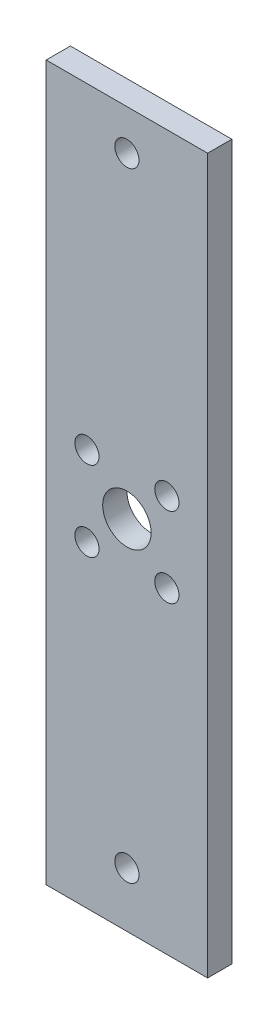
from build123d import *

# Parameters (mm, degrees)
SKETCH_1_W           = 170.943732818
SKETCH_1_H           = 105.520822726
EXTRUDE_1_DEPTH      = 3
SKETCH_3_OUTSIDE_W   = 213.126
SKETCH_3_OUTSIDE_H   = 147.702
SKETCH_3_OUTSIDE_W_2 = 20
SKETCH_3_OUTSIDE_H_2 = 88.500028981
CUT_EXTRUDE_1_DEPTH  = 101.489307663
SKETCH_2_R           = 1.5
SKETCH_2_R_2         = 3
CUT_EXTRUDE_2_DEPTH  = 51.191598861
SKETCH_4_R           = 1.5
CUT_EXTRUDE_3_DEPTH  = 51.191598861


with BuildPart() as part:
    # 草图1 → 凸台-拉伸1 (new body)
    with BuildSketch(Plane.XY):
        Rectangle(SKETCH_1_W, SKETCH_1_H)
    extrude(amount=EXTRUDE_1_DEPTH)

    # 草图3 outside → 切除-拉伸1 (cut, through all)
    with BuildSketch(Plane.XY.offset(3)):
        Rectangle(SKETCH_3_OUTSIDE_W, SKETCH_3_OUTSIDE_H)
        with Locations((-12.004302498, 0.761175983)):
            Rectangle(SKETCH_3_OUTSIDE_W_2, SKETCH_3_OUTSIDE_H_2, mode=Mode.SUBTRACT)
    extrude(amount=-CUT_EXTRUDE_1_DEPTH, mode=Mode.SUBTRACT)

    # 草图2 → 切除-拉伸2 (cut, through all)
    with BuildSketch(Plane(origin=(0, 0, 0), x_dir=(-1, 0, 0), z_dir=(0, 0, -1))):
        with Locations((7.05455503, 5.71092345)):
            Circle(SKETCH_2_R)
        with Locations((16.954049967, 5.71092345)):
            Circle(SKETCH_2_R)
        with Locations((16.954049967, -4.188571486)):
            Circle(SKETCH_2_R)
        with Locations((7.05455503, -4.188571486)):
            Circle(SKETCH_2_R)
        with Locations((12.004302498, 0.761175982)):
            Circle(SKETCH_2_R_2)
    extrude(amount=-CUT_EXTRUDE_2_DEPTH, mode=Mode.SUBTRACT)

    # 草图4 → 切除-拉伸3 (cut, through all)
    with BuildSketch(Plane(origin=(0, 0, 0), x_dir=(-1, 0, 0), z_dir=(0, 0, -1))):
        with Locations((12.004302498, 40.007436866)):
            Circle(SKETCH_4_R)
        with Locations((12.004302498, -36.685084901)):
            Circle(SKETCH_4_R)
    extrude(amount=-CUT_EXTRUDE_3_DEPTH, mode=Mode.SUBTRACT)


solid = part.part
